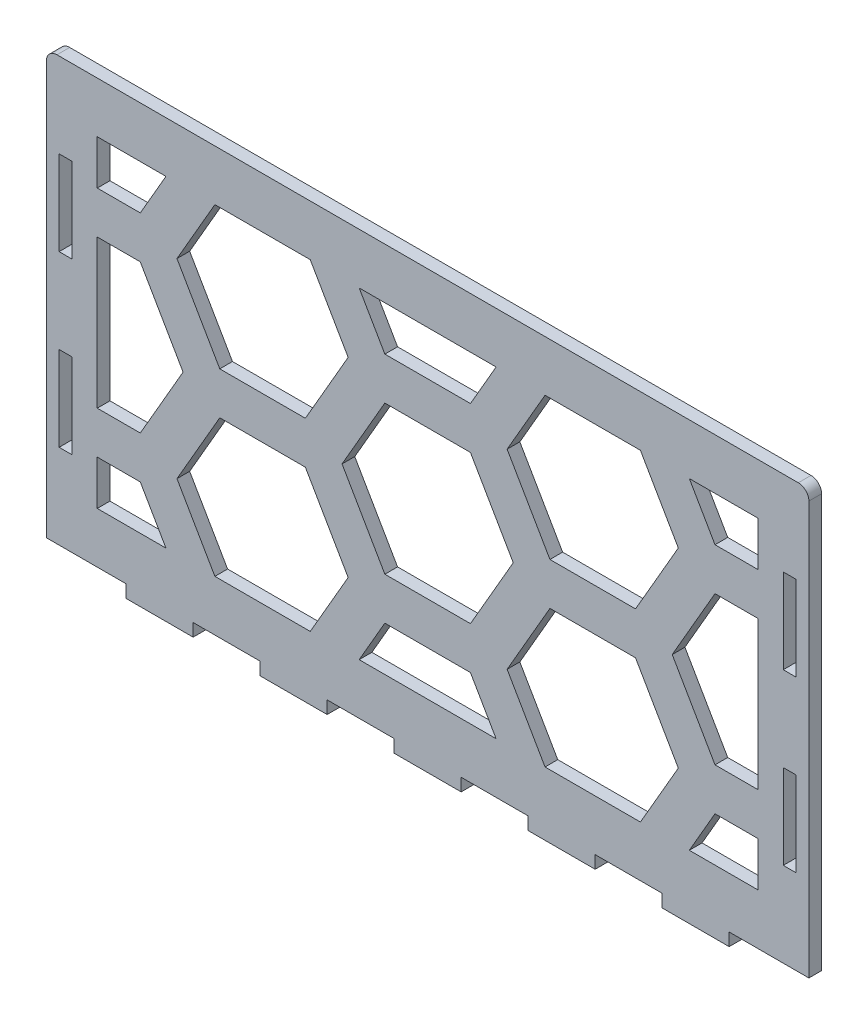
from build123d import *

# Parameters (mm, degrees)
SKETCH1_W               = 3.05
SKETCH1_H               = 20
BOSS_EXTRUDE1_DEPTH     = 3
FILLET3_R               = 2.5
CUT_EXTRUDE8_DEPTH      = 105.489233895
CUT_EXTRUDE8_DEPTH_BACK = 105.489233895


with BuildPart() as part:
    # Sketch1 → Boss-Extrude1 (new body)
    with BuildSketch(Plane.XY):
        Polygon((-90, 50), (-90, -50), (-71.181818182, -50), (-71.181818182, -53), (-55.363636364, -53), (-55.363636364, -50), (-39.545454545, -50), (-39.545454545, -53), (-23.727272727, -53), (-23.727272727, -50), (-7.909090909, -50), (-7.909090909, -53), (7.909090909, -53), (7.909090909, -50), (23.727272727, -50), (23.727272727, -53), (39.545454545, -53), (39.545454545, -50), (55.363636364, -50), (55.363636364, -53), (71.181818182, -53), (71.181818182, -50), (90, -50), (90, 50), align=None)
        with Locations((-85.475, -20)):
            Rectangle(SKETCH1_W, SKETCH1_H, mode=Mode.SUBTRACT)
        with Locations((85.475, -20)):
            Rectangle(SKETCH1_W, SKETCH1_H, mode=Mode.SUBTRACT)
        with Locations((-85.475, 20)):
            Rectangle(SKETCH1_W, SKETCH1_H, mode=Mode.SUBTRACT)
        with Locations((85.475, 20)):
            Rectangle(SKETCH1_W, SKETCH1_H, mode=Mode.SUBTRACT)
    extrude(amount=BOSS_EXTRUDE1_DEPTH)

    # Fillet3
    fillet3_edges = [part.edges().sort_by_distance(p)[0] for p in [
        (90, 50, 1.5),
        (-90, 50, 1.5),
    ]]
    fillet(fillet3_edges, radius=FILLET3_R)

    # Sketch6 → Cut-Extrude8 (cut, two sides: drawn at the far end of the back side and taken through both)
    with BuildSketch(Plane.XY.offset(-CUT_EXTRUDE8_DEPTH_BACK)):
        Polygon((-67.83865663, 27.5), (-61.776478803, 38), (-78, 38), (-78, 27.5), align=None)
        Polygon((-27.712812921, 38), (-50.229473419, 38), (-59.178402592, 22.5), (-49.074772881, 5), (-28.867513459, 5), (-18.763883749, 22.5), align=None)
        Polygon((-67.83865663, 17.5), (-78, 17.5), (-78, -17.5), (-67.83865663, -17.5), (-57.735026919, 0), align=None)
        Polygon((16.165807537, 38), (-16.165807537, 38), (-10.103629711, 27.5), (10.103629711, 27.5), align=None)
        Polygon((-67.83865663, -27.5), (-78, -27.5), (-78, -38), (-61.776478803, -38), align=None)
        Polygon((50.229473419, 38), (27.712812921, 38), (18.763883749, 22.5), (28.867513459, 5), (49.074772881, 5), (59.178402592, 22.5), align=None)
        Polygon((78, 38), (61.776478803, 38), (67.83865663, 27.5), (78, 27.5), align=None)
        Polygon((-59.178402592, -22.5), (-50.229473419, -38), (-27.712812921, -38), (-18.763883749, -22.5), (-28.867513459, -5), (-49.074772881, -5), align=None)
        Polygon((-10.103629711, -27.5), (-16.165807537, -38), (16.165807537, -38), (10.103629711, -27.5), align=None)
        Polygon((78, -17.5), (78, 17.5), (67.83865663, 17.5), (57.735026919, 0), (67.83865663, -17.5), align=None)
        Polygon((18.763883749, -22.5), (27.712812921, -38), (50.229473419, -38), (59.178402592, -22.5), (49.074772881, -5), (28.867513459, -5), align=None)
        Polygon((78, -38), (78, -27.5), (67.83865663, -27.5), (61.776478803, -38), align=None)
        Polygon((20.207259422, 0), (10.103629711, 17.5), (-10.103629711, 17.5), (-20.207259422, 0), (-10.103629711, -17.5), (10.103629711, -17.5), align=None)
    extrude(amount=CUT_EXTRUDE8_DEPTH + CUT_EXTRUDE8_DEPTH_BACK, mode=Mode.SUBTRACT)


solid = part.part
